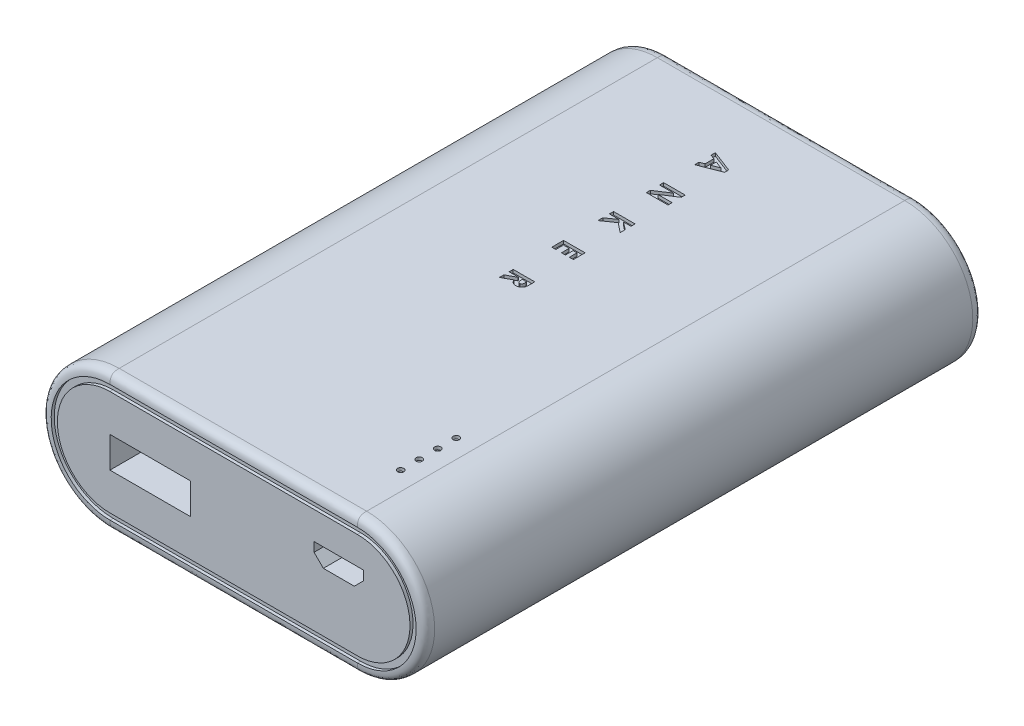
from build123d import *

# Parameters (mm, degrees)
BOSS_EXTRUDE2_DEPTH = 90
SKETCH2_W           = 13
SKETCH2_H           = 5
CUT_EXTRUDE1_DEPTH  = 10
CUT_EXTRUDE2_DEPTH  = 5
FILLET1_SIZE        = 1.5
CUT_EXTRUDE3_DEPTH  = 0.5
FILLET2_SIZE        = 1.5
CUT_EXTRUDE4_DEPTH  = 0.5
CUT_EXTRUDE5_DEPTH  = 0.5
SKETCH10_R          = 0.5
CUT_EXTRUDE6_DEPTH  = 0.5


with BuildPart() as part:
    # Sketch1 → Boss-Extrude2 (new body)
    with BuildSketch(Plane.XY):
        with BuildLine():
            Line((-23.779507134, 11), (16.220492866, 11))
            ThreePointArc((16.220492866, 11), (27.220492866, 0), (16.220492866, -11))
            Line((16.220492866, -11), (-23.779507134, -11))
            ThreePointArc((-23.779507134, -11), (-34.779507134, 0), (-23.779507134, 11))
        make_face()
    extrude(amount=BOSS_EXTRUDE2_DEPTH)

    # Sketch2 → Cut-Extrude1 (cut)
    with BuildSketch(Plane.XY.offset(90)):
        with Locations((-17.279507134, 0)):
            Rectangle(SKETCH2_W, SKETCH2_H)
    extrude(amount=-CUT_EXTRUDE1_DEPTH, mode=Mode.SUBTRACT)

    # Sketch3 → Cut-Extrude2 (cut)
    with BuildSketch(Plane.XY.offset(90)):
        Polygon((9.220492866, 4), (17.220492866, 4), (17.220492866, 2.5), (15.720492789, 1), (10.720492789, 1), (9.220492866, 2.5), align=None)
    extrude(amount=-CUT_EXTRUDE2_DEPTH, mode=Mode.SUBTRACT)

    # Fillet1
    # a fillet whose section is not a circle: 1.5 mm, written as the material it takes off along each edge
    with BuildSketch(Plane(origin=(-23.779507134, 0, 90), x_dir=(0, -1, 0), z_dir=(1, 0, 0))) as fillet1_piece_1:
        with BuildLine():
            add(Edge.make_bspline([(11, FILLET1_SIZE), (11, FILLET1_SIZE * 0.831801948466), (11, FILLET1_SIZE * 0.663603896932), (11 - FILLET1_SIZE * 0.0716919198361, FILLET1_SIZE * 0.292893218813), (11 - FILLET1_SIZE * 0.292893218813, FILLET1_SIZE * 0.0716919198361), (11 - FILLET1_SIZE * 0.663603896932, 0), (11 - FILLET1_SIZE * 0.831801948466, 0), (11 - FILLET1_SIZE, 0)], knots=[0, 0, 0, 0, 0, 0, 0.5, 0.5, 1, 1, 1, 1, 1, 1], degree=5))
            Line((11 - FILLET1_SIZE, 0), (11 - FILLET1_SIZE, -FILLET1_SIZE * 0.02))
            Line((11 - FILLET1_SIZE, -FILLET1_SIZE * 0.02), (11 + FILLET1_SIZE * 0.02, -FILLET1_SIZE * 0.02))
            Line((11 + FILLET1_SIZE * 0.02, -FILLET1_SIZE * 0.02), (11 + FILLET1_SIZE * 0.02, FILLET1_SIZE))
            Line((11 + FILLET1_SIZE * 0.02, FILLET1_SIZE), (11, FILLET1_SIZE))
        make_face()
    revolve(axis=Axis((-23.779507134, 0, 90), (0, 0, -1)), revolution_arc=180, mode=Mode.SUBTRACT)
    with BuildSketch(Plane(origin=(16.220492866, -11, 90), x_dir=(0, 1, 0), z_dir=(-1, 0, 0))) as fillet1_piece_2:
        with BuildLine():
            add(Edge.make_bspline([(FILLET1_SIZE, 0), (FILLET1_SIZE * 0.831801948466, 0), (FILLET1_SIZE * 0.663603896932, 0), (FILLET1_SIZE * 0.292893218813, FILLET1_SIZE * 0.0716919198361), (FILLET1_SIZE * 0.0716919198361, FILLET1_SIZE * 0.292893218813), (0, FILLET1_SIZE * 0.663603896932), (0, FILLET1_SIZE * 0.831801948466), (0, FILLET1_SIZE)], knots=[0, 0, 0, 0, 0, 0, 0.5, 0.5, 1, 1, 1, 1, 1, 1], degree=5))
            Line((0, FILLET1_SIZE), (-FILLET1_SIZE * 0.02, FILLET1_SIZE))
            Line((-FILLET1_SIZE * 0.02, FILLET1_SIZE), (-FILLET1_SIZE * 0.02, -FILLET1_SIZE * 0.02))
            Line((-FILLET1_SIZE * 0.02, -FILLET1_SIZE * 0.02), (FILLET1_SIZE, -FILLET1_SIZE * 0.02))
            Line((FILLET1_SIZE, -FILLET1_SIZE * 0.02), (FILLET1_SIZE, 0))
        make_face()
    extrude(amount=40, mode=Mode.SUBTRACT)
    with BuildSketch(Plane(origin=(16.220492866, 0, 90), x_dir=(0, 1, 0), z_dir=(-1, 0, 0))) as fillet1_piece_3:
        with BuildLine():
            add(Edge.make_bspline([(11, FILLET1_SIZE), (11, FILLET1_SIZE * 0.831801948466), (11, FILLET1_SIZE * 0.663603896932), (11 - FILLET1_SIZE * 0.0716919198361, FILLET1_SIZE * 0.292893218813), (11 - FILLET1_SIZE * 0.292893218813, FILLET1_SIZE * 0.0716919198361), (11 - FILLET1_SIZE * 0.663603896932, 0), (11 - FILLET1_SIZE * 0.831801948466, 0), (11 - FILLET1_SIZE, 0)], knots=[0, 0, 0, 0, 0, 0, 0.5, 0.5, 1, 1, 1, 1, 1, 1], degree=5))
            Line((11 - FILLET1_SIZE, 0), (11 - FILLET1_SIZE, -FILLET1_SIZE * 0.02))
            Line((11 - FILLET1_SIZE, -FILLET1_SIZE * 0.02), (11 + FILLET1_SIZE * 0.02, -FILLET1_SIZE * 0.02))
            Line((11 + FILLET1_SIZE * 0.02, -FILLET1_SIZE * 0.02), (11 + FILLET1_SIZE * 0.02, FILLET1_SIZE))
            Line((11 + FILLET1_SIZE * 0.02, FILLET1_SIZE), (11, FILLET1_SIZE))
        make_face()
    revolve(axis=Axis((16.220492866, 0, 90), (0, 0, -1)), revolution_arc=180, mode=Mode.SUBTRACT)
    with BuildSketch(Plane(origin=(-23.779507134, 11, 90), x_dir=(0, 0, -1), z_dir=(1, 0, 0))) as fillet1_piece_4:
        with BuildLine():
            add(Edge.make_bspline([(FILLET1_SIZE, 0), (FILLET1_SIZE * 0.831801948466, 0), (FILLET1_SIZE * 0.663603896932, 0), (FILLET1_SIZE * 0.292893218813, -FILLET1_SIZE * 0.0716919198361), (FILLET1_SIZE * 0.0716919198361, -FILLET1_SIZE * 0.292893218813), (0, -FILLET1_SIZE * 0.663603896932), (0, -FILLET1_SIZE * 0.831801948466), (0, -FILLET1_SIZE)], knots=[0, 0, 0, 0, 0, 0, 0.5, 0.5, 1, 1, 1, 1, 1, 1], degree=5))
            Line((0, -FILLET1_SIZE), (-FILLET1_SIZE * 0.02, -FILLET1_SIZE))
            Line((-FILLET1_SIZE * 0.02, -FILLET1_SIZE), (-FILLET1_SIZE * 0.02, FILLET1_SIZE * 0.02))
            Line((-FILLET1_SIZE * 0.02, FILLET1_SIZE * 0.02), (FILLET1_SIZE, FILLET1_SIZE * 0.02))
            Line((FILLET1_SIZE, FILLET1_SIZE * 0.02), (FILLET1_SIZE, 0))
        make_face()
    extrude(amount=40, mode=Mode.SUBTRACT)

    # Sketch4 → Cut-Extrude3 (cut)
    with BuildSketch(Plane.XY.offset(90)):
        with BuildLine():
            Line((-23.779507134, -9.5), (16.220492866, -9.5))
            add(Edge.make_bspline(
                [(16.220492866, -9.5), (18.109841089, -9.5), (19.855985474, -8.776855559), (21.60119589, -8.05409791), (22.938007288, -6.717514421), (24.273776687, -5.381972754), (24.997348425, -3.635492607), (25.720344564, -1.890401781), (25.720492866, 0), (25.720641052, 1.888911247), (24.997348425, 3.635492607), (24.274620998, 5.380709146), (22.938007288, 6.717514421), (21.602459551, 8.053253571), (19.855985474, 8.776855559), (18.110615724, 9.5), (16.220492866, 9.5)],
                knots=[0, 0, 0, 0.125, 0.125, 0.25, 0.25, 0.375, 0.375, 0.5, 0.5, 0.625, 0.625, 0.75, 0.75, 0.875, 0.875, 1, 1, 1], degree=2))
            Line((16.220492866, 9.5), (-23.779507134, 9.5))
            add(Edge.make_bspline(
                [(-23.779507134, 9.5), (-25.668855356, 9.5), (-27.414999741, 8.776855559), (-29.160210157, 8.05409791), (-30.497021555, 6.717514421), (-31.832790954, 5.381972754), (-32.556362692, 3.635492607), (-33.279358831, 1.890401781), (-33.279507134, 0), (-33.279655319, -1.888911247), (-32.556362692, -3.635492607), (-31.833635265, -5.380709146), (-30.497021555, -6.717514421), (-29.161473818, -8.053253571), (-27.414999741, -8.776855559), (-25.669629992, -9.5), (-23.779507134, -9.5)],
                knots=[0, 0, 0, 0.125, 0.125, 0.25, 0.25, 0.375, 0.375, 0.5, 0.5, 0.625, 0.625, 0.75, 0.75, 0.875, 0.875, 1, 1, 1], degree=2))
        make_face()
        with BuildLine():
            Line((-23.779507134, -8.5), (16.220492866, -8.5))
            add(Edge.make_bspline(
                [(16.220492866, -8.5), (16.781692401, -8.5), (17.33379703, -8.446703359), (18.148000785, -8.284991955), (18.417078259, -8.217470691), (18.950556997, -8.05502532), (19.215714324, -7.959643252), (19.987874093, -7.639891437), (20.476953159, -7.380478077), (21.400870898, -6.764026931), (21.837472361, -6.40364018), (22.622392927, -5.619110149), (22.975819303, -5.192199469), (23.44211974, -4.495171198), (23.586704699, -4.253313857), (23.848421745, -3.761789561), (23.966500847, -3.510804123), (24.17868741, -2.999035398), (24.272767086, -2.738240755), (24.435409088, -2.206221847), (24.504230617, -1.933561371), (24.668083856, -1.109812756), (24.720239379, -0.557825311), (24.720618273, 0.274004524), (24.707745977, 0.551923711), (24.65394616, 1.109148971), (24.612964199, 1.387198311), (24.450103641, 2.205115707), (24.287838178, 2.734416655), (23.968824508, 3.505866812), (23.849086243, 3.76064224), (23.586568934, 4.253708661), (23.443990229, 4.492037177), (22.982643623, 5.182662069), (22.630233946, 5.610575114), (21.838439857, 6.40336251), (21.408804653, 6.757820833), (20.718992557, 7.2194275), (20.481177685, 7.361953437), (19.989747018, 7.624253301), (19.734903519, 7.744436099), (18.962209669, 8.065034554), (18.43286477, 8.227679073), (17.344269643, 8.445495329), (16.782100017, 8.5), (16.220492866, 8.5)],
                knots=[0, 0, 0, 0, 0.0625, 0.0625, 0.09375, 0.09375, 0.125, 0.125, 0.1875, 0.1875, 0.25, 0.25, 0.3125, 0.3125, 0.34375, 0.34375, 0.375, 0.375, 0.40625, 0.40625, 0.4375, 0.4375, 0.5, 0.5, 0.53125, 0.53125, 0.5625, 0.5625, 0.625, 0.625, 0.65625, 0.65625, 0.6875, 0.6875, 0.75, 0.75, 0.8125, 0.8125, 0.84375, 0.84375, 0.875, 0.875, 0.9375, 0.9375, 1, 1, 1, 1], degree=3))
            Line((16.220492866, 8.5), (-23.779507134, 8.5))
            add(Edge.make_bspline(
                [(-23.779507134, 8.5), (-24.340706669, 8.5), (-24.892811298, 8.446703359), (-25.707015052, 8.284991955), (-25.976092526, 8.217470691), (-26.509571264, 8.05502532), (-26.774728591, 7.959643252), (-27.54688836, 7.639891437), (-28.035967426, 7.380478077), (-28.959885165, 6.764026931), (-29.396486628, 6.40364018), (-30.181407194, 5.619110149), (-30.534833571, 5.192199469), (-31.001134007, 4.495171198), (-31.145718966, 4.253313857), (-31.407436012, 3.761789561), (-31.525515114, 3.510804123), (-31.737701677, 2.999035398), (-31.831781353, 2.738240755), (-31.994423355, 2.206221847), (-32.063244884, 1.933561371), (-32.227098123, 1.109812756), (-32.279253646, 0.557825311), (-32.27963254, -0.274004524), (-32.266760244, -0.551923711), (-32.212960427, -1.109148971), (-32.171978467, -1.387198311), (-32.009117908, -2.205115707), (-31.846852445, -2.734416655), (-31.527838776, -3.505866812), (-31.40810051, -3.76064224), (-31.145583201, -4.253708661), (-31.003004496, -4.492037177), (-30.54165789, -5.182662069), (-30.189248213, -5.610575114), (-29.397454125, -6.40336251), (-28.96781892, -6.757820833), (-28.278006824, -7.2194275), (-28.040191952, -7.361953437), (-27.548761286, -7.624253301), (-27.293917786, -7.744436099), (-26.521223936, -8.065034554), (-25.991879037, -8.227679073), (-24.90328391, -8.445495329), (-24.341114284, -8.5), (-23.779507134, -8.5)],
                knots=[0, 0, 0, 0, 0.0625, 0.0625, 0.09375, 0.09375, 0.125, 0.125, 0.1875, 0.1875, 0.25, 0.25, 0.3125, 0.3125, 0.34375, 0.34375, 0.375, 0.375, 0.40625, 0.40625, 0.4375, 0.4375, 0.5, 0.5, 0.53125, 0.53125, 0.5625, 0.5625, 0.625, 0.625, 0.65625, 0.65625, 0.6875, 0.6875, 0.75, 0.75, 0.8125, 0.8125, 0.84375, 0.84375, 0.875, 0.875, 0.9375, 0.9375, 1, 1, 1, 1], degree=3))
        make_face(mode=Mode.SUBTRACT)
    extrude(amount=-CUT_EXTRUDE3_DEPTH, mode=Mode.SUBTRACT)

    # Fillet2
    # a fillet whose section is not a circle: 1.5 mm, written as the material it takes off along each edge
    with BuildSketch(Plane(origin=(-23.779507134, 11, 0), x_dir=(0, 0, 1), z_dir=(1, 0, 0))) as fillet2_piece_1:
        with BuildLine():
            add(Edge.make_bspline([(FILLET2_SIZE, 0), (FILLET2_SIZE * 0.831801948466, 0), (FILLET2_SIZE * 0.663603896932, 0), (FILLET2_SIZE * 0.292893218813, FILLET2_SIZE * 0.0716919198361), (FILLET2_SIZE * 0.0716919198361, FILLET2_SIZE * 0.292893218813), (0, FILLET2_SIZE * 0.663603896932), (0, FILLET2_SIZE * 0.831801948466), (0, FILLET2_SIZE)], knots=[0, 0, 0, 0, 0, 0, 0.5, 0.5, 1, 1, 1, 1, 1, 1], degree=5))
            Line((0, FILLET2_SIZE), (-FILLET2_SIZE * 0.02, FILLET2_SIZE))
            Line((-FILLET2_SIZE * 0.02, FILLET2_SIZE), (-FILLET2_SIZE * 0.02, -FILLET2_SIZE * 0.02))
            Line((-FILLET2_SIZE * 0.02, -FILLET2_SIZE * 0.02), (FILLET2_SIZE, -FILLET2_SIZE * 0.02))
            Line((FILLET2_SIZE, -FILLET2_SIZE * 0.02), (FILLET2_SIZE, 0))
        make_face()
    extrude(amount=40, mode=Mode.SUBTRACT)
    with BuildSketch(Plane(origin=(16.220492866, 0, 0), x_dir=(0, 1, 0), z_dir=(-1, 0, 0))) as fillet2_piece_2:
        with BuildLine():
            add(Edge.make_bspline([(11 - FILLET2_SIZE, 0), (11 - FILLET2_SIZE * 0.831801948466, 0), (11 - FILLET2_SIZE * 0.663603896932, 0), (11 - FILLET2_SIZE * 0.292893218813, -FILLET2_SIZE * 0.0716919198361), (11 - FILLET2_SIZE * 0.0716919198361, -FILLET2_SIZE * 0.292893218813), (11, -FILLET2_SIZE * 0.663603896932), (11, -FILLET2_SIZE * 0.831801948466), (11, -FILLET2_SIZE)], knots=[0, 0, 0, 0, 0, 0, 0.5, 0.5, 1, 1, 1, 1, 1, 1], degree=5))
            Line((11, -FILLET2_SIZE), (11 + FILLET2_SIZE * 0.02, -FILLET2_SIZE))
            Line((11 + FILLET2_SIZE * 0.02, -FILLET2_SIZE), (11 + FILLET2_SIZE * 0.02, FILLET2_SIZE * 0.02))
            Line((11 + FILLET2_SIZE * 0.02, FILLET2_SIZE * 0.02), (11 - FILLET2_SIZE, FILLET2_SIZE * 0.02))
            Line((11 - FILLET2_SIZE, FILLET2_SIZE * 0.02), (11 - FILLET2_SIZE, 0))
        make_face()
    revolve(axis=Axis((16.220492866, 0, 0), (0, 0, -1)), revolution_arc=180, mode=Mode.SUBTRACT)
    with BuildSketch(Plane(origin=(16.220492866, -11, 0), x_dir=(0, 1, 0), z_dir=(-1, 0, 0))) as fillet2_piece_3:
        with BuildLine():
            add(Edge.make_bspline([(FILLET2_SIZE, 0), (FILLET2_SIZE * 0.831801948466, 0), (FILLET2_SIZE * 0.663603896932, 0), (FILLET2_SIZE * 0.292893218813, -FILLET2_SIZE * 0.0716919198361), (FILLET2_SIZE * 0.0716919198361, -FILLET2_SIZE * 0.292893218813), (0, -FILLET2_SIZE * 0.663603896932), (0, -FILLET2_SIZE * 0.831801948466), (0, -FILLET2_SIZE)], knots=[0, 0, 0, 0, 0, 0, 0.5, 0.5, 1, 1, 1, 1, 1, 1], degree=5))
            Line((0, -FILLET2_SIZE), (-FILLET2_SIZE * 0.02, -FILLET2_SIZE))
            Line((-FILLET2_SIZE * 0.02, -FILLET2_SIZE), (-FILLET2_SIZE * 0.02, FILLET2_SIZE * 0.02))
            Line((-FILLET2_SIZE * 0.02, FILLET2_SIZE * 0.02), (FILLET2_SIZE, FILLET2_SIZE * 0.02))
            Line((FILLET2_SIZE, FILLET2_SIZE * 0.02), (FILLET2_SIZE, 0))
        make_face()
    extrude(amount=40, mode=Mode.SUBTRACT)
    with BuildSketch(Plane(origin=(-23.779507134, 0, 0), x_dir=(0, -1, 0), z_dir=(1, 0, 0))) as fillet2_piece_4:
        with BuildLine():
            add(Edge.make_bspline([(11 - FILLET2_SIZE, 0), (11 - FILLET2_SIZE * 0.831801948466, 0), (11 - FILLET2_SIZE * 0.663603896932, 0), (11 - FILLET2_SIZE * 0.292893218813, -FILLET2_SIZE * 0.0716919198361), (11 - FILLET2_SIZE * 0.0716919198361, -FILLET2_SIZE * 0.292893218813), (11, -FILLET2_SIZE * 0.663603896932), (11, -FILLET2_SIZE * 0.831801948466), (11, -FILLET2_SIZE)], knots=[0, 0, 0, 0, 0, 0, 0.5, 0.5, 1, 1, 1, 1, 1, 1], degree=5))
            Line((11, -FILLET2_SIZE), (11 + FILLET2_SIZE * 0.02, -FILLET2_SIZE))
            Line((11 + FILLET2_SIZE * 0.02, -FILLET2_SIZE), (11 + FILLET2_SIZE * 0.02, FILLET2_SIZE * 0.02))
            Line((11 + FILLET2_SIZE * 0.02, FILLET2_SIZE * 0.02), (11 - FILLET2_SIZE, FILLET2_SIZE * 0.02))
            Line((11 - FILLET2_SIZE, FILLET2_SIZE * 0.02), (11 - FILLET2_SIZE, 0))
        make_face()
    revolve(axis=Axis((-23.779507134, 0, 0), (0, 0, -1)), revolution_arc=180, mode=Mode.SUBTRACT)

    # Sketch5 → Cut-Extrude4 (cut)
    with BuildSketch(Plane(origin=(0, 0, 0), x_dir=(-1, 0, 0), z_dir=(0, 0, -1))):
        with BuildLine():
            Line((-16.220492866, -9.5), (23.779507134, -9.5))
            add(Edge.make_bspline(
                [(23.779507134, -9.5), (25.668855356, -9.5), (27.414999741, -8.776855559), (29.160210157, -8.05409791), (30.497021555, -6.717514421), (31.832790954, -5.381972754), (32.556362692, -3.635492607), (33.279358831, -1.890401781), (33.279507134, 0), (33.279655319, 1.888911247), (32.556362692, 3.635492607), (31.833635265, 5.380709146), (30.497021555, 6.717514421), (29.161473818, 8.053253571), (27.414999741, 8.776855559), (25.669629992, 9.5), (23.779507134, 9.5)],
                knots=[0, 0, 0, 0.125, 0.125, 0.25, 0.25, 0.375, 0.375, 0.5, 0.5, 0.625, 0.625, 0.75, 0.75, 0.875, 0.875, 1, 1, 1], degree=2))
            Line((23.779507134, 9.5), (-16.220492866, 9.5))
            add(Edge.make_bspline(
                [(-16.220492866, 9.5), (-18.109841089, 9.5), (-19.855985474, 8.776855559), (-21.60119589, 8.05409791), (-22.938007288, 6.717514421), (-24.273776687, 5.381972754), (-24.997348425, 3.635492607), (-25.720344564, 1.890401781), (-25.720492866, 0), (-25.720641052, -1.888911247), (-24.997348425, -3.635492607), (-24.274620998, -5.380709146), (-22.938007288, -6.717514421), (-21.60245955, -8.053253571), (-19.855985474, -8.776855559), (-18.110615724, -9.5), (-16.220492866, -9.5)],
                knots=[0, 0, 0, 0.125, 0.125, 0.25, 0.25, 0.375, 0.375, 0.5, 0.5, 0.625, 0.625, 0.75, 0.75, 0.875, 0.875, 1, 1, 1], degree=2))
        make_face()
        with BuildLine():
            Line((23.779507134, 8.5), (-16.220492866, 8.5))
            add(Edge.make_bspline(
                [(-16.220492866, 8.5), (-17.484597848, 8.501621615), (-19.891234156, 7.768063898), (-22.34688343, 6.127429778), (-24.22595863, 3.315760019), (-24.885349323, -7.988e-05), (-24.225888389, -3.315908342), (-22.346824549, -6.127539696), (-19.890820728, -7.768147431), (-17.485316634, -8.50159377), (-16.220492866, -8.5)],
                knots=[0, 0, 0, 0.09375, 0.1875, 0.3125, 0.4375, 0.5625, 0.6875, 0.8125, 0.90625, 1, 1, 1], degree=2))
            Line((-16.220492866, -8.5), (23.779507134, -8.5))
            add(Edge.make_bspline(
                [(23.779507134, -8.5), (25.043612115, -8.501621615), (27.450248423, -7.768063898), (29.905897697, -6.127429778), (31.784972897, -3.315760019), (32.44436359, 7.988e-05), (31.784902656, 3.315908342), (29.905838816, 6.127539696), (27.449834995, 7.768147431), (25.044330901, 8.50159377), (23.779507134, 8.5)],
                knots=[0, 0, 0, 0.09375, 0.1875, 0.3125, 0.4375, 0.5625, 0.6875, 0.8125, 0.90625, 1, 1, 1], degree=2))
        make_face(mode=Mode.SUBTRACT)
    extrude(amount=-CUT_EXTRUDE4_DEPTH, mode=Mode.SUBTRACT)

    # Sketch9 → Cut-Extrude5 (cut)
    # profile 1 of 5: a face of its own
    with BuildSketch(Plane(origin=(0, 11, 0), x_dir=(1, 0, 0), z_dir=(0, 1, 0))):
        Polygon((-2.295632935, -11.451322115), (-2.294931813, -12.123697917), (-5.773197037, -13.469150641), (-5.774599281, -12.780649038), (-5.058052807, -12.507211538), (-5.060156172, -11.087439904), (-5.77810489, -10.804887821), (-5.779507134, -10.115685096), align=None)
        Polygon((-3.219010339, -11.794170673), (-4.414422999, -11.332832532), (-4.412319634, -12.257612179), align=None, mode=Mode.SUBTRACT)
    # profile 2 of 5: a face of its own
    with BuildSketch(Plane(origin=(0, 11, 0), x_dir=(1, 0, 0), z_dir=(0, 1, 0))):
        Polygon((-2.2977363, -18.483072917), (-2.296334057, -19.117588141), (-4.584795595, -20.615184295), (-2.294230691, -20.610977564), (-2.292828448, -21.27353766), (-5.773898159, -21.279847756), (-5.775300403, -20.643229167), (-3.493850082, -19.147736378), (-5.777403768, -19.151943109), (-5.778806012, -18.489383013), align=None)
    # profile 3 of 5: a face of its own
    with BuildSketch(Plane(origin=(0, 11, 0), x_dir=(1, 0, 0), z_dir=(0, 1, 0))):
        Polygon((-2.2977363, -26.575620994), (-2.296334057, -27.245192308), (-3.493850082, -27.247295673), (-2.294931813, -28.189603365), (-2.293529569, -28.986778846), (-3.847916589, -27.773137019), (-5.774599281, -29.111578526), (-5.776001525, -28.325620994), (-4.232131332, -27.248697917), (-5.777403768, -27.251502404), (-5.778806012, -26.58193109), align=None)
    # profile 4 of 5: a face of its own
    with BuildSketch(Plane(origin=(0, 11, 0), x_dir=(1, 0, 0), z_dir=(0, 1, 0))):
        Polygon((-2.2977363, -34.662560096), (-2.294230691, -36.563301282), (-2.942768352, -36.564703526), (-2.944871717, -35.322315705), (-3.574479089, -35.323717949), (-3.572375723, -36.566105769), (-4.208994313, -36.566806891), (-4.211097678, -35.324419071), (-5.126762743, -35.325821314), (-5.124659377, -36.568209135), (-5.775300403, -36.569611378), (-5.778806012, -34.668870192), align=None)
    # profile 5 of 5: a face of its own
    with BuildSketch(Plane(origin=(0, 11, 0), x_dir=(1, 0, 0), z_dir=(0, 1, 0))):
        with BuildLine():
            Line((-2.2977363, -42.795072115), (-2.296334057, -43.498297276))
            add(Edge.make_bspline(
                [(-2.296334057, -43.498297276), (-2.296511029, -43.544576991), (-2.29685257, -43.633893033), (-2.302029066, -43.762700479), (-2.309325037, -43.881286877), (-2.320318772, -43.989392199), (-2.335074267, -44.086908848), (-2.352168375, -44.174375974), (-2.373117396, -44.251419706), (-2.396855792, -44.319723176), (-2.426144952, -44.380282376), (-2.45738219, -44.437719056), (-2.494200978, -44.491590077), (-2.534689816, -44.542935771), (-2.579976724, -44.590760017), (-2.629211216, -44.6357062), (-2.682452993, -44.677920917), (-2.740090079, -44.716239763), (-2.800718111, -44.751460783), (-2.864929306, -44.781469934), (-2.931368972, -44.80747026), (-3.000693863, -44.828803219), (-3.072776731, -44.844454044), (-3.147618261, -44.856744112), (-3.225196398, -44.863544239), (-3.277892815, -44.864832938), (-3.304547198, -44.865484776)],
                knots=[0, 0, 0, 0, 1.704099851, 3.288772522, 4.74628543, 6.078762758, 7.288589392, 8.377221794, 9.358471116, 10.22683732, 11.035309445, 11.832758846, 12.632387897, 13.434790879, 14.238439004, 15.054706339, 15.888035334, 16.737778595, 17.601355192, 18.467543698, 19.344946566, 20.226980006, 21.135242332, 22.059149126, 23.018297898, 24, 24, 24, 24], degree=3))
            add(Edge.make_bspline(
                [(-3.304547198, -44.865484776), (-3.332613389, -44.865219168), (-3.387690672, -44.864697938), (-3.468466469, -44.856517707), (-3.545903761, -44.844325461), (-3.619657792, -44.825859773), (-3.690027188, -44.802804875), (-3.756836091, -44.774642456), (-3.820423576, -44.741758495), (-3.879961852, -44.702843847), (-3.936555721, -44.659579362), (-3.988328069, -44.609716139), (-4.037863237, -44.555820034), (-4.083161749, -44.495935742), (-4.125502239, -44.431489289), (-4.163190343, -44.36127334), (-4.198651519, -44.286353646), (-4.21848695, -44.233464361), (-4.228625723, -44.206430288)],
                knots=[0, 0, 0, 0, 1.100820088, 2.160256721, 3.182443235, 4.174441506, 5.140149035, 6.085436491, 7.016560865, 7.945016931, 8.873201214, 9.807346458, 10.761665528, 11.742966364, 12.750234487, 13.784404072, 14.867510074, 16, 16, 16, 16], degree=3))
            Line((-4.228625723, -44.206430288), (-5.774599281, -45.033052885))
            Line((-5.774599281, -45.033052885), (-5.776001525, -44.308794071))
            Line((-5.776001525, -44.308794071), (-4.302944634, -43.522836538))
            Line((-4.302944634, -43.522836538), (-4.302944634, -43.461137821))
            Line((-4.302944634, -43.461137821), (-5.777403768, -43.463942308))
            Line((-5.777403768, -43.463942308), (-5.778806012, -42.801382212))
            Line((-5.778806012, -42.801382212), (-2.2977363, -42.795072115))
        make_face()
        with BuildLine():
            Line((-3.657211461, -43.460436699), (-3.657211461, -43.668669872))
            add(Edge.make_bspline(
                [(-3.657211461, -43.668669872), (-3.65699406, -43.694152569), (-3.656578874, -43.742818667), (-3.652044272, -43.812723992), (-3.646181253, -43.876427408), (-3.637115187, -43.934288037), (-3.625386088, -43.985831676), (-3.611432022, -44.031447752), (-3.594892173, -44.070932907), (-3.569049972, -44.114674139), (-3.52716576, -44.159840442), (-3.462255617, -44.197500373), (-3.384302208, -44.22016258), (-3.328083212, -44.222642022), (-3.298237102, -44.223958333)],
                knots=[0, 0, 0, 0, 1.204442213, 2.300207935, 3.31048724, 4.227743141, 5.066596467, 5.807393998, 6.480510688, 7.08493195, 8.20275414, 9.347176241, 10.591642024, 12, 12, 12, 12], degree=3))
            add(Edge.make_bspline(
                [(-3.298237102, -44.223958333), (-3.279939688, -44.223392741), (-3.244147181, -44.222286357), (-3.192468306, -44.210435869), (-3.144137514, -44.192515225), (-3.100540064, -44.166181829), (-3.06197592, -44.133821796), (-3.028377052, -44.096191688), (-3.001226862, -44.053238113), (-2.983085841, -44.013366533), (-2.97215933, -43.976960844), (-2.964451643, -43.944214961), (-2.958584223, -43.906197467), (-2.952462088, -43.863268876), (-2.949707302, -43.814983248), (-2.946527717, -43.761723447), (-2.945456388, -43.703261377), (-2.945072476, -43.662592923), (-2.944871717, -43.641326122)],
                knots=[0, 0, 0, 0, 1.125716544, 2.202071649, 3.250604208, 4.290495278, 5.323180086, 6.343436455, 7.386215978, 8.443515603, 9.031209397, 9.7264289, 10.514902865, 11.400991014, 12.397383246, 13.493503652, 14.689274951, 16, 16, 16, 16], degree=3))
            Line((-2.944871717, -43.641326122), (-2.944871717, -43.459034455))
            Line((-2.944871717, -43.459034455), (-3.657211461, -43.460436699))
        make_face(mode=Mode.SUBTRACT)
    extrude(amount=-CUT_EXTRUDE5_DEPTH, mode=Mode.SUBTRACT)

    # Sketch10 → Cut-Extrude6 (cut)
    with BuildSketch(Plane(origin=(0, 11, 0), x_dir=(1, 0, 0), z_dir=(0, 1, 0))):
        with Locations(Location((13.220492866, -71, 0), (0, 0, 180))):
            Circle(SKETCH10_R)
        with Locations(Location((13.220492866, -74, 0), (0, 0, 180))):
            Circle(SKETCH10_R)
        with Locations(Location((13.220492866, -77, 0), (0, 0, 180))):
            Circle(SKETCH10_R)
        with Locations(Location((13.220492866, -80, 0), (0, 0, 180))):
            Circle(SKETCH10_R)
    extrude(amount=-CUT_EXTRUDE6_DEPTH, mode=Mode.SUBTRACT)


solid = part.part
